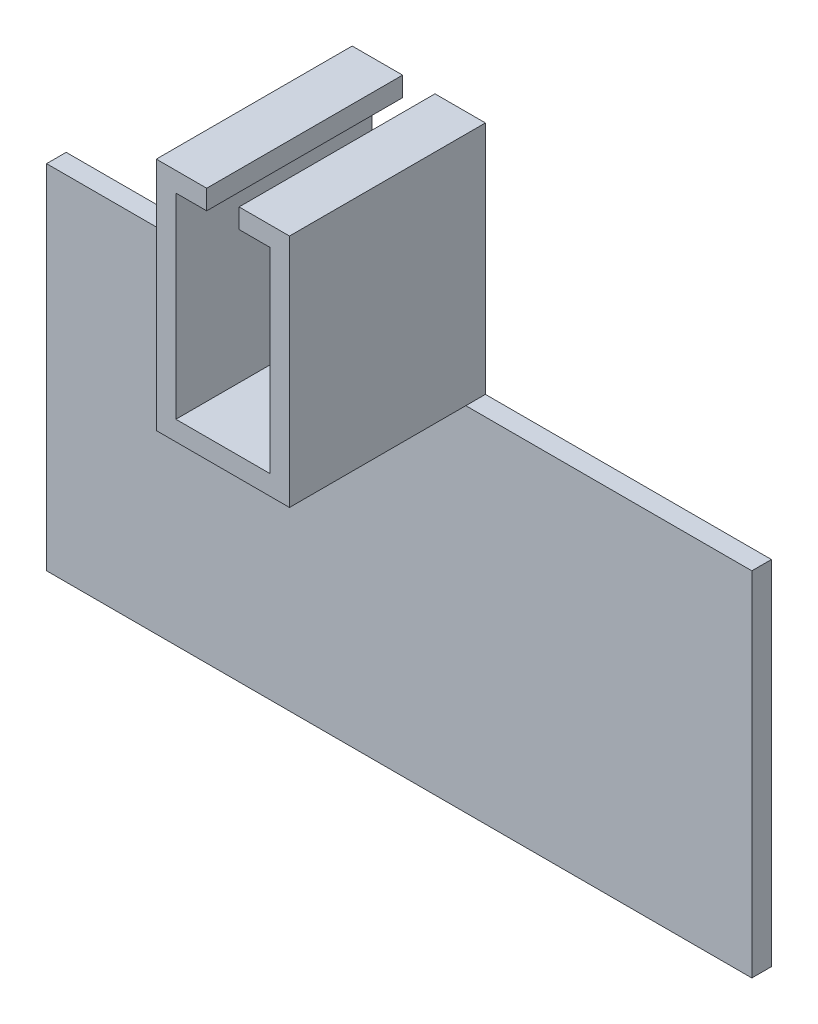
from build123d import *

# Parameters (mm, degrees)
AUFSATZ_LINEAR_AUSTRAGEN1_DEPTH = 500
SKIZZE2_W                       = 450
SKIZZE2_H                       = 900
SCHNITT_LINEAR_AUSTRAGEN1_DEPTH = 2096.829191513


with BuildPart() as part:
    # Skizze1 → Aufsatz-Linear austragen1 (new body)
    with BuildSketch(Plane.XY):
        Polygon((-120, 0), (120, 0), (120, 500), (41.348314607, 500), (41.348314607, 550), (170, 550), (170, -50), (900, -50), (900, -950), (513.483146067, -950), (-513.483146067, -950), (-900, -950), (-900, -50), (-170, -50), (-170, 550), (-41.348314607, 550), (-41.348314607, 500), (-120, 500), align=None)
    extrude(amount=AUFSATZ_LINEAR_AUSTRAGEN1_DEPTH)

    # Skizze2 → Schnitt-Linear austragen1 (cut, through all)
    with BuildSketch(Plane(origin=(900, 0, 0), x_dir=(0, 0, -1), z_dir=(1, 0, 0))):
        with Locations((-275, -500)):
            Rectangle(SKIZZE2_W, SKIZZE2_H)
    extrude(amount=-SCHNITT_LINEAR_AUSTRAGEN1_DEPTH, mode=Mode.SUBTRACT)


solid = part.part
